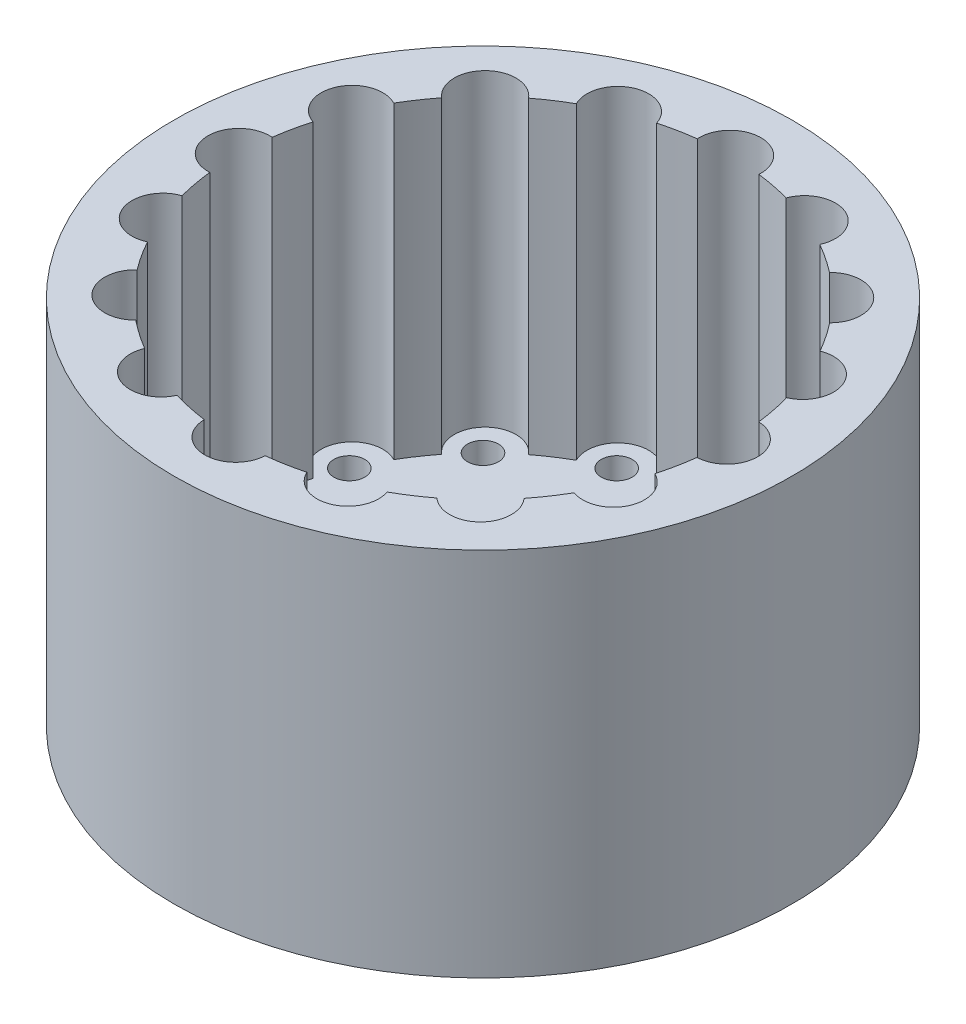
from build123d import *

# Parameters (mm, degrees)
SKETCH1_R           = 50
BOSS_EXTRUDE1_DEPTH = 50
BOSS_EXTRUDE2_START = 10
SKETCH2_R           = 50
BOSS_EXTRUDE2_DEPTH = 10
SKETCH3_R           = 2.5
CUT_EXTRUDE1_DEPTH  = 4


with BuildPart() as part:
    # Sketch1 → Boss-Extrude1 (new body)
    with BuildSketch(Plane(origin=(0, 0, 0), x_dir=(1, 0, 0), z_dir=(0, 1, 0))):
        Circle(SKETCH1_R)
        with BuildLine():
            ThreePointArc((-38.472091197, 10.949803601), (-39.142843019, 8.236373014), (-39.622464899, 5.482725176))
            ThreePointArc((-39.622464899, 5.482725176), (-45.027736203, 0.561560709), (-39.746875, -4.492875219))
            ThreePointArc((-39.746875, -4.492875219), (-39.333953887, -7.269117664), (-38.72736158, -10.009568673))
            ThreePointArc((-38.72736158, -10.009568673), (-41.748946282, -16.583911093), (-35.039748856, -19.292900251))
            ThreePointArc((-35.039748856, -19.292900251), (-33.590491244, -21.718169766), (-31.973653194, -24.035088963))
            ThreePointArc((-31.973653194, -24.035088963), (-32.157729031, -31.176050772), (-25.014492656, -31.213381059))
            ThreePointArc((-25.014492656, -31.213381059), (-22.728868069, -32.915020223), (-20.32789937, -34.449622744))
            ThreePointArc((-20.32789937, -34.449622744), (-17.707258167, -40.991172437), (-11.148020432, -38.415122549))
            ThreePointArc((-11.148020432, -38.415122549), (-8.358901204, -39.11686044), (-5.526568431, -39.6163734))
            ThreePointArc((-5.526568431, -39.6163734), (-0.59402965, -44.528471783), (4.46778962, -39.749702589))
            ThreePointArc((4.46778962, -39.749702589), (7.33562934, -39.321604013), (10.164921368, -38.686875986))
            ThreePointArc((10.164921368, -38.686875986), (16.574401115, -41.242300251), (19.433073291, -34.962203341))
            ThreePointArc((19.433073291, -34.962203341), (21.927230073, -33.454395546), (24.304976528, -31.768980405))
            ThreePointArc((24.304976528, -31.768980405), (31.177616874, -31.629495833), (31.415975195, -24.759573957))
            ThreePointArc((31.415975195, -24.759573957), (33.136656406, -22.404508524), (34.681152562, -19.930320042))
            ThreePointArc((34.681152562, -19.930320042), (40.985236081, -17.155873875), (38.537324177, -10.717959006))
            ThreePointArc((38.537324177, -10.717959006), (39.213686022, -7.892200491), (39.683137427, -5.024798895))
            ThreePointArc((39.683137427, -5.024798895), (44.500790375, -0.031685054), (39.690252613, 4.968284165))
            ThreePointArc((39.690252613, 4.968284165), (39.229069194, 7.815377799), (38.563928149, 10.62183815))
            ThreePointArc((38.563928149, 10.62183815), (41.191547229, 17.128956276), (34.724740733, 19.854278657))
            ThreePointArc((34.724740733, 19.854278657), (33.21843503, 22.283078202), (31.542548716, 24.598122296))
            ThreePointArc((31.542548716, 24.598122296), (31.568070741, 31.71029047), (24.456089141, 31.652799306))
            ThreePointArc((24.456089141, 31.652799306), (22.154728904, 33.304173721), (19.742272443, 34.788542349))
            ThreePointArc((19.742272443, 34.788542349), (17.102427339, 41.494962196), (10.503764758, 38.596255335))
            ThreePointArc((10.503764758, 38.596255335), (7.766185163, 39.238837496), (4.99022482, 39.6875))
            ThreePointArc((4.99022482, 39.6875), (0, 45), (-4.99022482, 39.6875))
            ThreePointArc((-4.99022482, 39.6875), (-7.752560801, 39.241531584), (-10.476960655, 38.603539934))
            ThreePointArc((-10.476960655, 38.603539934), (-17.137978748, 41.698652845), (-19.697351689, 34.813996272))
            ThreePointArc((-19.697351689, 34.813996272), (-22.077028029, 33.355731643), (-24.349225183, 31.735078903))
            ThreePointArc((-24.349225183, 31.735078903), (-31.708929174, 32.096652706), (-31.436823309, 24.733098071))
            ThreePointArc((-31.436823309, 24.733098071), (-33.084428294, 22.481561432), (-34.571077134, 20.120651724))
            ThreePointArc((-34.571077134, 20.120651724), (-41.501374638, 17.653486782), (-38.472091197, 10.949803601))
        make_face(mode=Mode.SUBTRACT)
    extrude(amount=BOSS_EXTRUDE1_DEPTH)

    # Sketch2 → Boss-Extrude2 (add)
    with BuildSketch(Plane.XZ.offset(BOSS_EXTRUDE2_START)):
        Circle(SKETCH2_R)
    extrude(amount=-BOSS_EXTRUDE2_DEPTH)

    # Sketch3 → Cut-Extrude1 (cut)
    with BuildSketch(Plane(origin=(0, 0, 0), x_dir=(1, 0, 0), z_dir=(0, 1, 0))):
        with Locations((0, 40)):
            Circle(SKETCH3_R)
        with Locations((15.307337295, 36.9551813)):
            Circle(SKETCH3_R)
        with Locations((28.284271247, 28.284271247)):
            Circle(SKETCH3_R)
        with Locations((36.9551813, 15.307337295)):
            Circle(SKETCH3_R)
        with Locations((40, 0)):
            Circle(SKETCH3_R)
        with Locations((36.9551813, -15.307337295)):
            Circle(SKETCH3_R)
        with Locations((28.284271247, -28.284271247)):
            Circle(SKETCH3_R)
        with Locations((15.307337295, -36.9551813)):
            Circle(SKETCH3_R)
        with Locations((0, -40)):
            Circle(SKETCH3_R)
        with Locations((-15.307337295, -36.9551813)):
            Circle(SKETCH3_R)
        with Locations((-28.284271247, -28.284271247)):
            Circle(SKETCH3_R)
        with Locations((-36.9551813, -15.307337295)):
            Circle(SKETCH3_R)
        with Locations((-40, 0)):
            Circle(SKETCH3_R)
        with Locations((-36.9551813, 15.307337295)):
            Circle(SKETCH3_R)
        with Locations((-28.284271247, 28.284271247)):
            Circle(SKETCH3_R)
        with Locations((-15.307337295, 36.9551813)):
            Circle(SKETCH3_R)
    extrude(amount=-CUT_EXTRUDE1_DEPTH, mode=Mode.SUBTRACT)


solid = part.part
